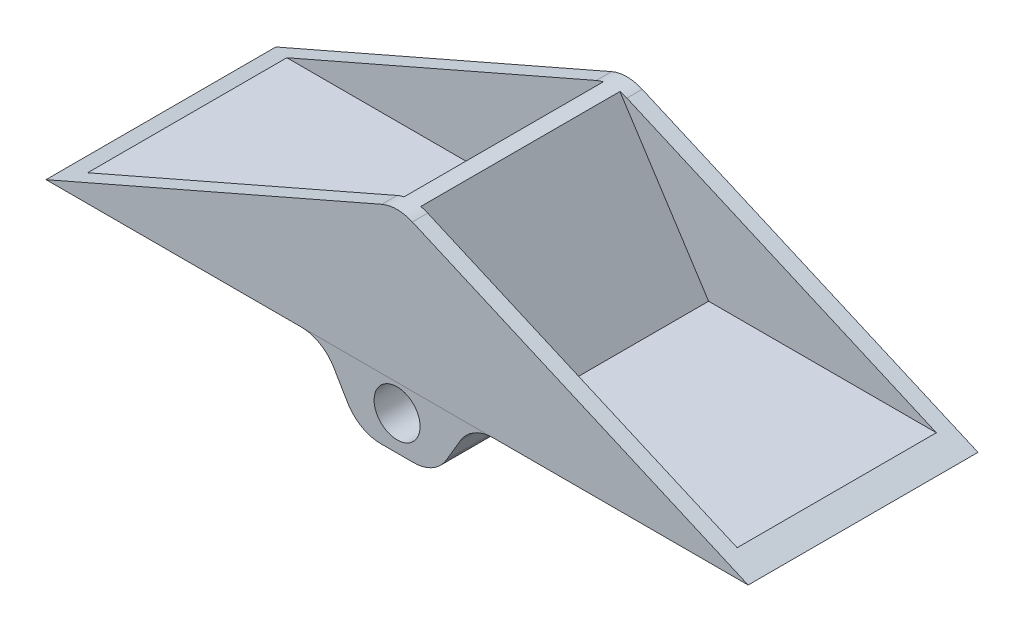
from build123d import *

# Parameters (mm, degrees)
BOSS_EXTRU_1_DEPTH         = 30
ENL_V_MAT_EXTRU_1_DEPTH    = 26
CONG_1_R                   = 5
CONG_2_R                   = 5
CONG_1_OF_SYM_TRIE1_R      = 5
CONG_2_OF_SYM_TRIE1_R      = 5
CONG_3_R                   = 5
ESQUISSE7_R                = 3
ENL_V_MAT_EXTRU_2_DEPTH    = 30
SURFACE_EXTRUSION1_1_BACK  = 40
SURFACE_EXTRUSION1_1_DEPTH = 40
SURFACE_EXTRUSION1_2_BACK  = 40
SURFACE_EXTRUSION1_2_DEPTH = 40


with BuildPart() as part:
    # Esquisse1 → Boss.-Extru.1 (new body)
    with BuildSketch(Plane.XY):
        Polygon((0, -8), (5, -8), (9.70678761, 0), (45.82575695, 0), (0, 20), align=None)
    boss_extru_1 = extrude(amount=BOSS_EXTRU_1_DEPTH)

    # Esquisse3 → Enlèv. mat.-Extru.1 (cut)
    with BuildSketch(Plane.XY.offset(2)):
        Polygon((1, 19.56356422), (12.66384565, 1.5), (42.388825178, 1.5), align=None)
    enl_v_mat_extru_1 = extrude(amount=ENL_V_MAT_EXTRU_1_DEPTH, mode=Mode.SUBTRACT)

    # Congé1
    cong_1_edges = [part.edges().sort_by_distance(p)[0] for p in [
        (5, -8, 15),
    ]]
    fillet(cong_1_edges, radius=CONG_1_R)

    # Congé2
    cong_2_edges = [part.edges().sort_by_distance(p)[0] for p in [
        (9.70678761, 0, 15),
    ]]
    fillet(cong_2_edges, radius=CONG_2_R)

    # Symétrie1: Boss.-Extru.1, Enlèv. mat.-Extru.1 across plane
    add(boss_extru_1.mirror(Plane(origin=(0, 0, 0), x_dir=(0, 0, 1), z_dir=(1, 0, 0))))
    add(enl_v_mat_extru_1.mirror(Plane(origin=(0, 0, 0), x_dir=(0, 0, 1), z_dir=(1, 0, 0))), mode=Mode.SUBTRACT)

    # Congé1 of Symétrie1
    cong_1_of_sym_trie1_edges = [part.edges().sort_by_distance(p)[0] for p in [
        (-5, -8, 15),
    ]]
    fillet(cong_1_of_sym_trie1_edges, radius=CONG_1_OF_SYM_TRIE1_R)

    # Congé2 of Symétrie1
    cong_2_of_sym_trie1_edges = [part.edges().sort_by_distance(p)[0] for p in [
        (-9.70678761, 0, 15),
    ]]
    fillet(cong_2_of_sym_trie1_edges, radius=CONG_2_OF_SYM_TRIE1_R)

    # Congé3
    # the kernel refuses this fillet: 5 mm, written as the material it takes off along each edge
    with BuildSketch(Plane(origin=(0, 20, -5.455447256), x_dir=(-0.9165151389911679, -0.4000000000000003, 0), z_dir=(0, 0, 1))) as cong_3_piece_1:
        with BuildLine():
            CenterArc((CONG_3_R * 0.436435780472, CONG_3_R), CONG_3_R, 222.843643044, 47.156356956)
            Line((-CONG_3_R * 0.296776330721, CONG_3_R * 0.32), (0, 0))
            Line((0, 0), (CONG_3_R * 0.436435780472, 0))
        make_face()
    extrude(amount=40.910894512, mode=Mode.SUBTRACT)

    # Esquisse7 → Enlèv. mat.-Extru.2 (cut)
    with BuildSketch(Plane.XY):
        with Locations((0, -3.5)):
            Circle(ESQUISSE7_R)
    extrude(amount=ENL_V_MAT_EXTRU_2_DEPTH, mode=Mode.SUBTRACT)


with BuildPart() as body_2:
    # Fractionner1: the piece behind the surface
    add(part.part)
    # Surface-Extrusion1: a surface, the sketch's curves swept straight by 40 mm
    with BuildLine(Plane.XY.offset(30).offset(-SURFACE_EXTRUSION1_1_BACK), mode=Mode.PRIVATE) as surface_extrusion1_1_path:
        Line((-12.566238981, 0), (12.17539903, -0.015298993))
    surface_extrusion1_1 = Shell.extrude(surface_extrusion1_1_path.wire(), (0 * SURFACE_EXTRUSION1_1_DEPTH, 0 * SURFACE_EXTRUSION1_1_DEPTH, 1 * SURFACE_EXTRUSION1_1_DEPTH))
    split(bisect_by=surface_extrusion1_1, keep=Keep.BOTTOM)


with BuildPart() as part_1:
    add(part.part)

    # Fractionner1: split by a surface, the side it looks to stays
    # Surface-Extrusion1: a surface, the sketch's curves swept straight by 40 mm
    with BuildLine(Plane.XY.offset(30).offset(-SURFACE_EXTRUSION1_2_BACK), mode=Mode.PRIVATE) as surface_extrusion1_2_path:
        Line((-12.566238981, 0), (12.17539903, -0.015298993))
    surface_extrusion1_2 = Shell.extrude(surface_extrusion1_2_path.wire(), (0 * SURFACE_EXTRUSION1_2_DEPTH, 0 * SURFACE_EXTRUSION1_2_DEPTH, 1 * SURFACE_EXTRUSION1_2_DEPTH))
    split(bisect_by=surface_extrusion1_2, keep=Keep.TOP)


solid = Compound([body_2.part, part_1.part])
